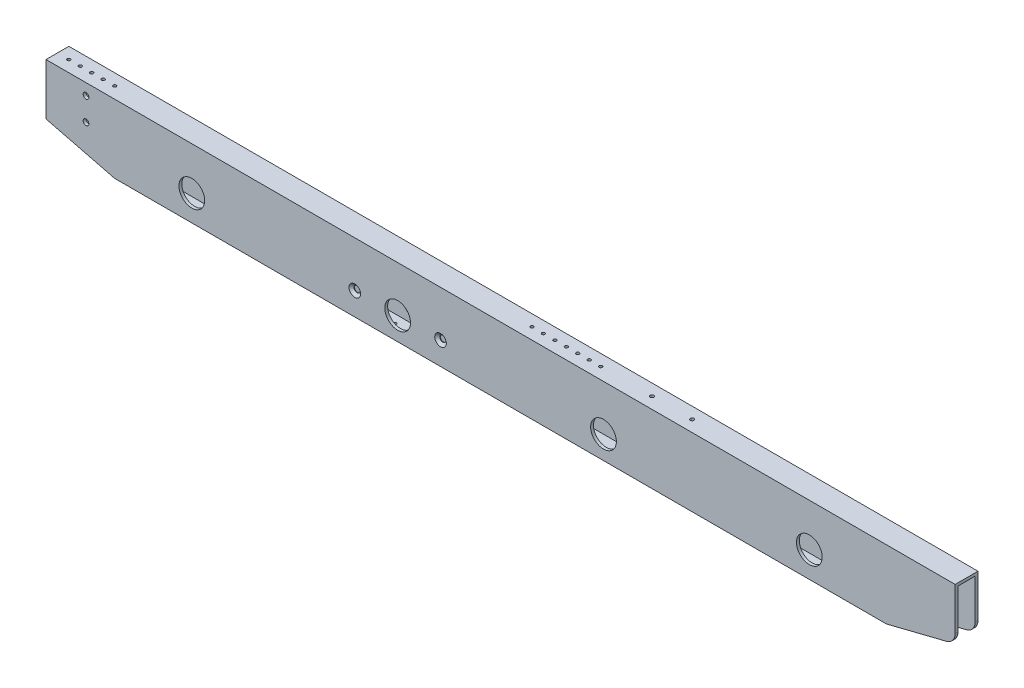
from build123d import *

# Parameters (mm, degrees)
SKETCH1_W                                           = 1009.65
SKETCH1_H                                           = 76.2
SKETCH1_R                                           = 14.2875
BOSS_EXTRUDE2_DEPTH                                 = 12.7
SKETCH3_W                                           = 19.05
SKETCH3_H                                           = 69.85
CUT_EXTRUDE2_DEPTH                                  = 1011.448426442
CUT_EXTRUDE3_DEPTH                                  = 507.897475457
FILLET1_R                                           = 12.7
SKETCH9_R                                           = 1.7272
CUT_EXTRUDE5_DEPTH                                  = 6.35
SKETCH12_R                                          = 1.7272
CUT_EXTRUDE8_DEPTH                                  = 5.08
CSK_FOR_1_4_FLAT_HEAD_MACHINE_SCREW_100_D           = 6.7564
CSK_FOR_1_4_FLAT_HEAD_MACHINE_SCREW_100_CSINK_D     = 12.8778
CSK_FOR_1_4_FLAT_HEAD_MACHINE_SCREW_100_CSINK_ANGLE = 100
CUT_EXTRUDE9_START                                  = -6.35
SKETCH15_R                                          = 1.7272
CUT_EXTRUDE9_DEPTH                                  = 6.35
SKETCH16_R                                          = 17.4625
CUT_EXTRUDE10_DEPTH                                 = 3.81
F_1_4_0_25_DIAMETER_HOLE1_D                         = 6.35
F_10_32_TAPPED_HOLE2_D                              = 4.0386
F_10_32_TAPPED_HOLE2_DEPTH                          = 13.716
F_10_32_TAPPED_HOLE2_TIP                            = 1.213317848


with BuildPart() as part:
    # Sketch1 → Boss-Extrude2 (new, symmetric)
    with BuildSketch(Plane.XY):
        Rectangle(SKETCH1_W, SKETCH1_H)
        with Locations((114.3, -12.7)):
            Circle(SKETCH1_R, mode=Mode.SUBTRACT)
        with Locations((-342.9, -9.525)):
            Circle(SKETCH1_R, mode=Mode.SUBTRACT)
        with Locations((342.9, -9.525)):
            Circle(SKETCH1_R, mode=Mode.SUBTRACT)
        with Locations((-114.3, -12.7)):
            Circle(SKETCH1_R, mode=Mode.SUBTRACT)
    extrude(amount=BOSS_EXTRUDE2_DEPTH, both=True)

    # Sketch3 → Cut-Extrude2 (cut, through all)
    with BuildSketch(Plane(origin=(504.825, 0, 0), x_dir=(0, 0, -1), z_dir=(1, 0, 0))):
        Rectangle(SKETCH3_W, SKETCH3_H)
    extrude(amount=-CUT_EXTRUDE2_DEPTH, mode=Mode.SUBTRACT)

    # Sketch4 → Cut-Extrude3 (cut, through all)
    with BuildSketch(Plane.XY.offset(12.7)):
        Polygon((-504.825, -38.1), (-504.825, -19.05), (-428.625, -38.1), align=None)
        Polygon((428.625, -38.1), (504.825, -38.1), (504.825, -19.05), align=None)
    extrude(amount=-CUT_EXTRUDE3_DEPTH, mode=Mode.SUBTRACT)

    # Fillet1
    fillet1_edges = [part.edges().sort_by_distance(p)[0] for p in [
        (504.825, -19.05, -11.1125),
        (504.825, -19.05, 11.1125),
    ]]
    fillet(fillet1_edges, radius=FILLET1_R)

    # Sketch9 → Cut-Extrude5 (cut)
    with BuildSketch(Plane(origin=(0, 38.1, 0), x_dir=(1, 0, 0), z_dir=(0, 1, 0))):
        with Locations((-492.125, 0)):
            Circle(SKETCH9_R)
        with Locations((-441.325, 0)):
            Circle(SKETCH9_R)
        with Locations((-479.425, 0)):
            Circle(SKETCH9_R)
        with Locations((-466.725, 0)):
            Circle(SKETCH9_R)
        with Locations((-454.025, 0)):
            Circle(SKETCH9_R)
    extrude(amount=-CUT_EXTRUDE5_DEPTH, mode=Mode.SUBTRACT)

    # Sketch12 → Cut-Extrude8 (cut)
    with BuildSketch(Plane(origin=(0, 38.1, 0), x_dir=(1, 0, 0), z_dir=(0, 1, 0))):
        with Locations((98.425, 0)):
            Circle(SKETCH12_R)
        with Locations((85.725, 0)):
            Circle(SKETCH12_R)
        with Locations((73.025, 0)):
            Circle(SKETCH12_R)
        with Locations((60.325, 0)):
            Circle(SKETCH12_R)
        with Locations((47.625, 0)):
            Circle(SKETCH12_R)
        with Locations((34.925, 0)):
            Circle(SKETCH12_R)
        with Locations((22.225, 0)):
            Circle(SKETCH12_R)
    extrude(amount=-CUT_EXTRUDE8_DEPTH, mode=Mode.SUBTRACT)

    # CSK for 1/4 Flat Head Machine Screw (100)1 (through all)
    with Locations(Plane.XY.offset(12.7)):
        with Locations((-66.675, -12.7), (-161.925, -12.7)):
            CounterSinkHole(CSK_FOR_1_4_FLAT_HEAD_MACHINE_SCREW_100_D / 2, CSK_FOR_1_4_FLAT_HEAD_MACHINE_SCREW_100_CSINK_D / 2, counter_sink_angle=CSK_FOR_1_4_FLAT_HEAD_MACHINE_SCREW_100_CSINK_ANGLE)

    # Sketch15 → Cut-Extrude9 (cut)
    with BuildSketch(Plane(origin=(0, -38.1, 0), x_dir=(-1, 0, 0), z_dir=(0, -1, 0)).offset(CUT_EXTRUDE9_START)):
        with Locations((415.925, 0)):
            Circle(SKETCH15_R)
        with Locations((396.875, 0)):
            Circle(SKETCH15_R)
        with Locations((377.825, 0)):
            Circle(SKETCH15_R)
        with Locations((358.775, 0)):
            Circle(SKETCH15_R)
        with Locations((339.725, 0)):
            Circle(SKETCH15_R)
        with Locations((320.675, 0)):
            Circle(SKETCH15_R)
        with Locations((301.625, 0)):
            Circle(SKETCH15_R)
        with Locations((282.575, 0)):
            Circle(SKETCH15_R)
        with Locations((263.525, 0)):
            Circle(SKETCH15_R)
        with Locations((244.475, 0)):
            Circle(SKETCH15_R)
        with Locations((225.425, 0)):
            Circle(SKETCH15_R)
        with Locations((206.375, 0)):
            Circle(SKETCH15_R)
        with Locations((187.325, 0)):
            Circle(SKETCH15_R)
        with Locations((168.275, 0)):
            Circle(SKETCH15_R)
        with Locations((149.225, 0)):
            Circle(SKETCH15_R)
        with Locations((130.175, 0)):
            Circle(SKETCH15_R)
        with Locations((111.125, 0)):
            Circle(SKETCH15_R)
        with Locations((92.075, 0)):
            Circle(SKETCH15_R)
        with Locations((73.025, 0)):
            Circle(SKETCH15_R)
        with Locations((53.975, 0)):
            Circle(SKETCH15_R)
        with Locations((34.925, 0)):
            Circle(SKETCH15_R)
        with Locations((15.875, 0)):
            Circle(SKETCH15_R)
        with Locations((-3.175, 0)):
            Circle(SKETCH15_R)
        with Locations((-22.225, 0)):
            Circle(SKETCH15_R)
        with Locations((-41.275, 0)):
            Circle(SKETCH15_R)
        with Locations((-60.325, 0)):
            Circle(SKETCH15_R)
    extrude(amount=CUT_EXTRUDE9_DEPTH, mode=Mode.SUBTRACT)

    # Sketch16 → Cut-Extrude10 (cut)
    with BuildSketch(Plane(origin=(0, 0, -12.7), x_dir=(-1, 0, 0), z_dir=(0, 0, -1))):
        with Locations((114.3, -12.7)):
            Circle(SKETCH16_R)
    extrude(amount=-CUT_EXTRUDE10_DEPTH, mode=Mode.SUBTRACT)

    # 1/4 (0.25) Diameter Hole1 (through all)
    with Locations(Plane.XY.offset(12.7)):
        with Locations((-460.375, 25.4), (-460.375, 0)):
            Hole(F_1_4_0_25_DIAMETER_HOLE1_D / 2)

    # #10-32 Tapped Hole2
    with Locations(Plane(origin=(0, 38.1, 0), x_dir=(1, 0, 0), z_dir=(0, 1, 0))):
        with Locations((155.575, 0), (200.025, 0)):
            Hole(F_10_32_TAPPED_HOLE2_D / 2, depth=F_10_32_TAPPED_HOLE2_DEPTH)
            with Locations((0, 0, -(F_10_32_TAPPED_HOLE2_DEPTH + F_10_32_TAPPED_HOLE2_TIP / 2))):  # 118° drill point
                Cone(0, F_10_32_TAPPED_HOLE2_D / 2, F_10_32_TAPPED_HOLE2_TIP, mode=Mode.SUBTRACT)


solid = part.part
